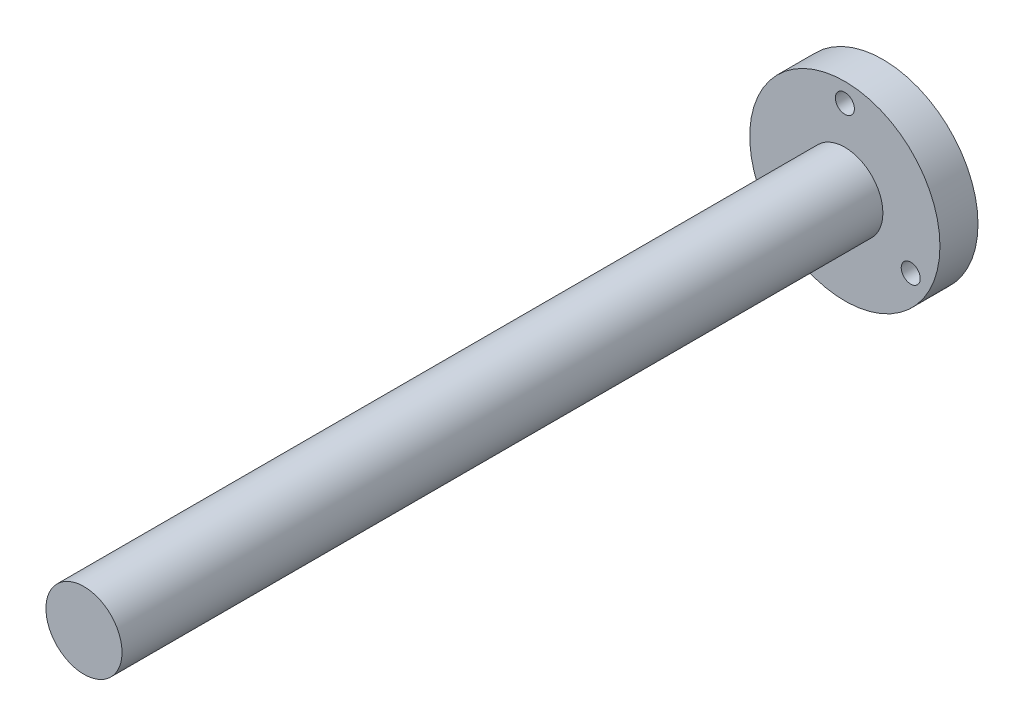
from build123d import *

# Parameters (mm, degrees)
SKETCH1_R           = 25
SKETCH1_R_2         = 2.5
BOSS_EXTRUDE1_DEPTH = 10
SKETCH2_R           = 10
BOSS_EXTRUDE2_DEPTH = 200


with BuildPart() as part:
    # Sketch1 → Boss-Extrude1 (new body)
    with BuildSketch(Plane.XY):
        Circle(SKETCH1_R)
        with Locations((0, 20)):
            Circle(SKETCH1_R_2, mode=Mode.SUBTRACT)
        with Locations((17.320508076, -10)):
            Circle(SKETCH1_R_2, mode=Mode.SUBTRACT)
        with Locations((-17.320508076, -10)):
            Circle(SKETCH1_R_2, mode=Mode.SUBTRACT)
    extrude(amount=BOSS_EXTRUDE1_DEPTH)

    # Sketch2 → Boss-Extrude2 (add)
    with BuildSketch(Plane.XY.offset(10)):
        Circle(SKETCH2_R)
    extrude(amount=BOSS_EXTRUDE2_DEPTH)


solid = part.part
